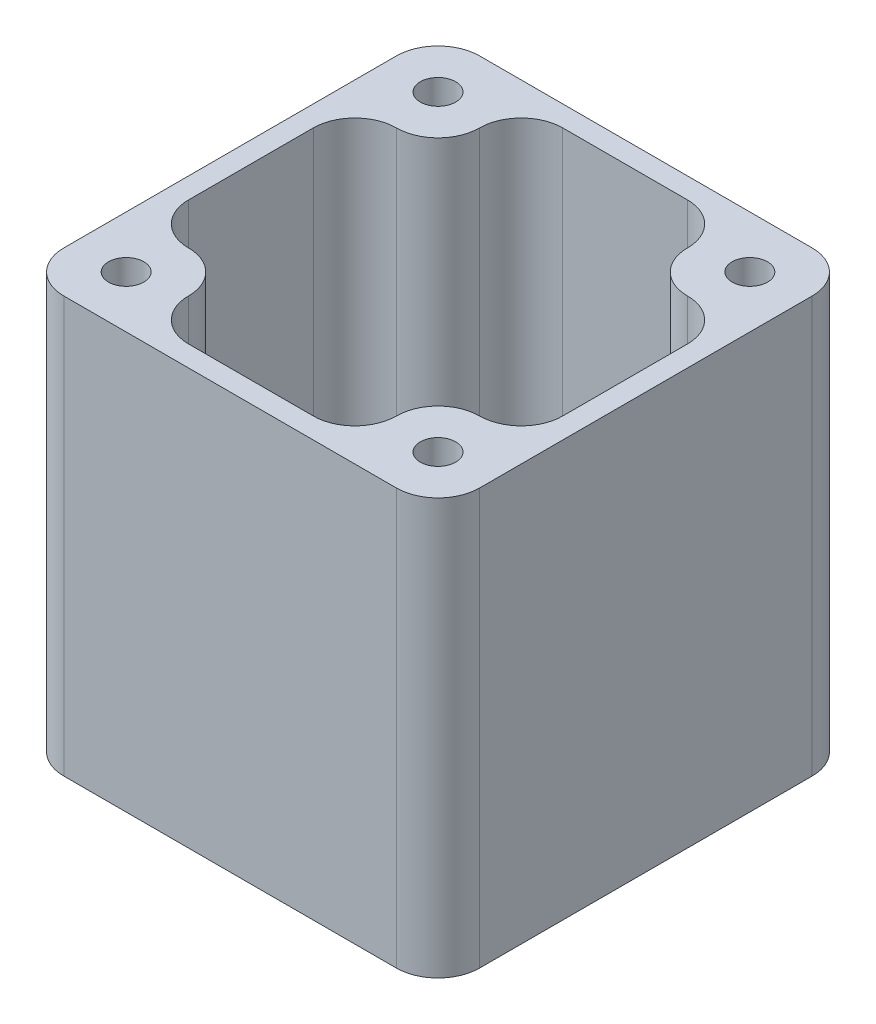
from build123d import *

# Parameters (mm, degrees)
SKETCH1_W           = 40
SKETCH1_H           = 40
SKETCH1_R           = 1.7
BOSS_EXTRUDE1_DEPTH = 40
SKETCH2_W           = 36
SKETCH2_H           = 20
CUT_EXTRUDE1_DEPTH  = 38
CIRPATTERN1_COUNT   = 2
CIRPATTERN1_ANGLE   = 90
FILLET1_R           = 4


with BuildPart() as part:
    # Sketch1 → Boss-Extrude1 (new body)
    with BuildSketch(Plane(origin=(0, 0, 0), x_dir=(1, 0, 0), z_dir=(0, 1, 0))):
        Rectangle(SKETCH1_W, SKETCH1_H)
        with Locations(Location((15, 15, 0), (0, 0, 270))):
            Circle(SKETCH1_R, mode=Mode.SUBTRACT)
        with Locations(Location((-15, 15, 0), (0, 0, 270))):
            Circle(SKETCH1_R, mode=Mode.SUBTRACT)
        with Locations(Location((-15, -15, 0), (0, 0, 270))):
            Circle(SKETCH1_R, mode=Mode.SUBTRACT)
        with Locations(Location((15, -15, 0), (0, 0, 270))):
            Circle(SKETCH1_R, mode=Mode.SUBTRACT)
    extrude(amount=BOSS_EXTRUDE1_DEPTH)

    # Sketch2 → Cut-Extrude1 (cut)
    with BuildSketch(Plane(origin=(0, 40, 0), x_dir=(1, 0, 0), z_dir=(0, 1, 0))):
        Rectangle(SKETCH2_W, SKETCH2_H)
    cut_extrude1 = extrude(amount=-CUT_EXTRUDE1_DEPTH, mode=Mode.SUBTRACT)

    # CirPattern1: Cut-Extrude1 ×2 about axis
    cirpattern1_axis = Axis((0, 0, 0), (0, -1, 0))
    for i in range(1, CIRPATTERN1_COUNT):
        add(cut_extrude1.rotate(cirpattern1_axis, i * CIRPATTERN1_ANGLE / (CIRPATTERN1_COUNT - 1)), mode=Mode.SUBTRACT)

    # Fillet1
    fillet1_edges = [part.edges().sort_by_distance(p)[0] for p in [
        (-18, 21, 10),
        (-10, 21, 10),
        (-10, 21, 18),
        (10, 21, 18),
        (10, 21, 10),
        (18, 21, 10),
        (18, 21, -10),
        (10, 21, -10),
        (10, 21, -18),
        (-10, 21, -18),
        (-18, 21, -10),
        (-10, 21, -10),
        (-20, 20, -20),
        (20, 20, -20),
        (20, 20, 20),
        (-20, 20, 20),
    ]]
    fillet(fillet1_edges, radius=FILLET1_R - 0.0001)  # a hair under: the kernel refuses the full size


solid = part.part
